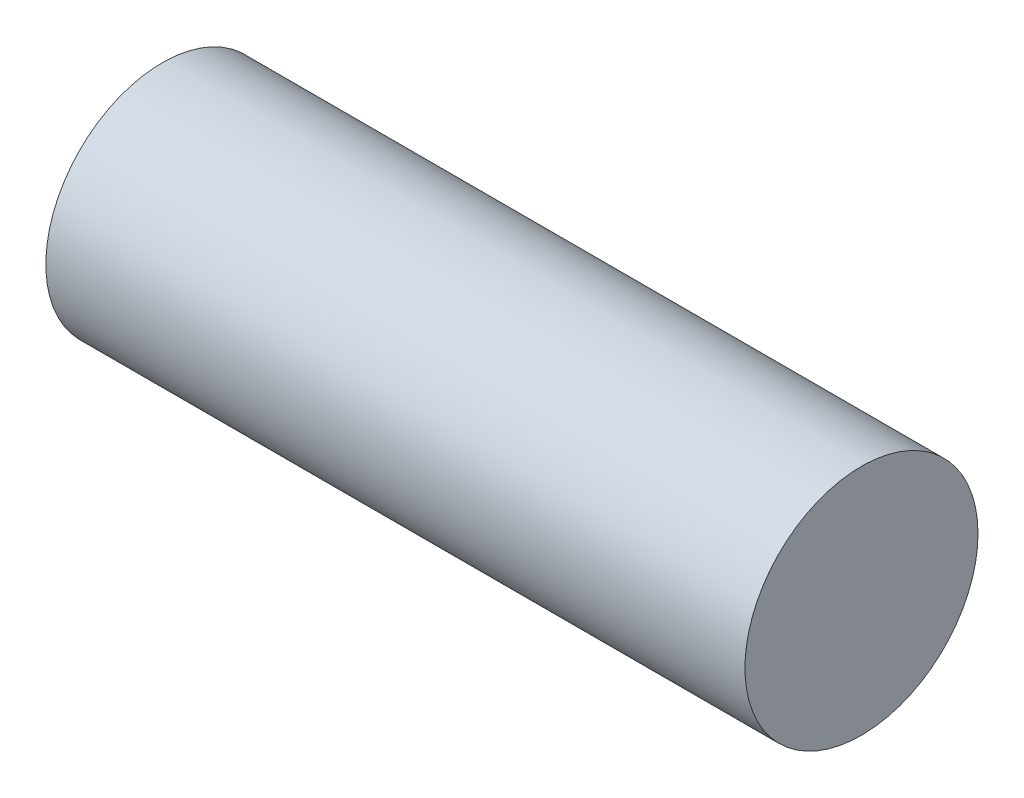
from build123d import *

# Parameters (mm, degrees)
SKETCH14_R          = 0.5
BOSS_EXTRUDE1_DEPTH = 1.5


with BuildPart() as part:
    # Sketch14 → Boss-Extrude1 (new, symmetric)
    with BuildSketch(Plane(origin=(0, 0, 0), x_dir=(0, 0, -1), z_dir=(1, 0, 0))):
        Circle(SKETCH14_R)
    extrude(amount=BOSS_EXTRUDE1_DEPTH, both=True)


solid = part.part
